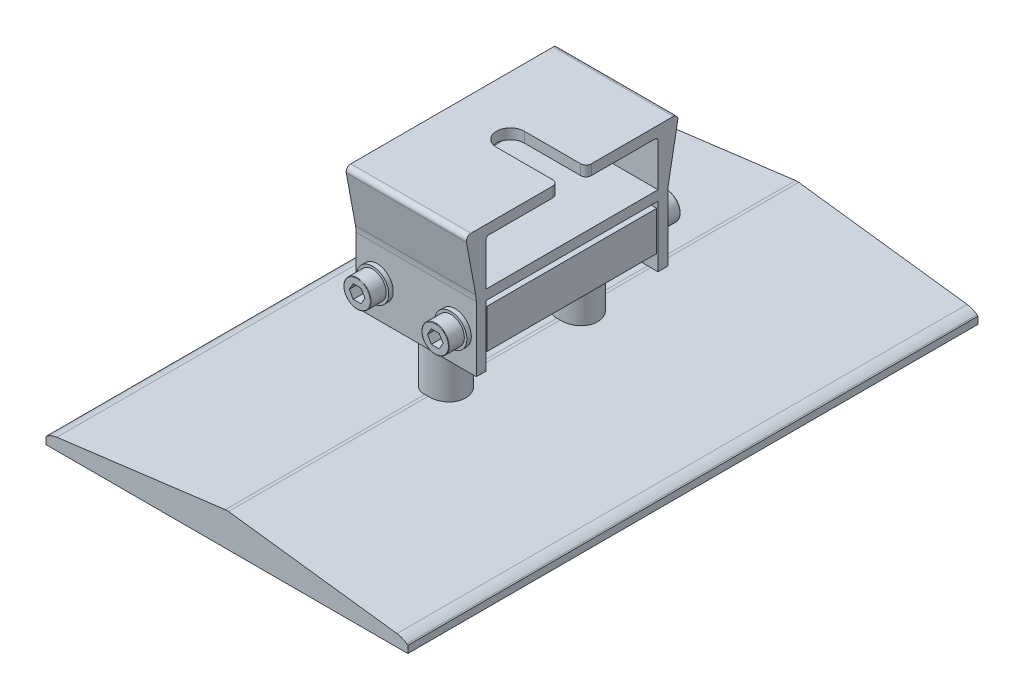
from build123d import *

# Parameters (mm, degrees)
BOSS_EXTRUDE1_DEPTH      = 86.315
FILLET1_R                = 6.35
FILLET2_R                = 3.81
SKETCH2_R                = 5.925
BOSS_EXTRUDE2_DEPTH      = 30.52
SKETCH4_W                = 36.2
SKETCH4_H                = 51.45
BOSS_EXTRUDE3_DEPTH      = 11.87
CUT_EXTRUDE2_DEPTH       = 19.99
CUT_EXTRUDE2_DEPTH_BACK  = 19.99
SKETCH5_W                = 11.85
SKETCH5_H                = 1
BOSS_EXTRUDE4_REACH      = 108.687
BOSS_EXTRUDE5_DEPTH      = 18.2
FILLET3_R                = 1.4
FILLET4_R                = 10.16
FILLET5_R                = 0.762
BOSS_EXTRUDE6_DEPTH      = 18.2
BOSS_EXTRUDE6_DEPTH_BACK = 18.2
SKETCH10_W               = 52.030012
SKETCH10_H               = 3
CUT_EXTRUDE3_DEPTH       = 9.476
FILLET6_R                = 1.65
SKETCH12_R               = 4.875
BOSS_EXTRUDE7_DEPTH      = 1.35
SKETCH13_R               = 4.1
BOSS_EXTRUDE8_DEPTH      = 4.7
CUT_EXTRUDE4_DEPTH       = 3.68
FILLET7_R                = 0.127
FILLET7_OF_MIRROR1_R     = 0.127
MIRROR2_OUTLINE_W        = 4.875
MIRROR2_OUTLINE_H        = 1.35
MIRROR2_START            = -35.065
MIRROR2_2_OUTLINE_R      = 4.1
MIRROR2_2_DEPTH          = 6.05
MIRROR2_START_2          = -31.385
MIRROR2_3_DEPTH          = 2.37
MIRROR2_START_3          = -30.365
MIRROR2_4_OUTLINE_R      = 4.875
MIRROR2_4_OUTLINE_R_2    = 4.1
MIRROR2_4_DEPTH          = 1.35


with BuildPart() as part:
    # Sketch1 → Boss-Extrude1 (new, symmetric)
    with BuildSketch(Plane.XY):
        Polygon((-54.775, 0), (54.775, 0), (54.775, 2.16), (53.145, 3.3779968), (0, 10.16), (-53.145, 3.3779968), (-54.775, 2.16), align=None)
    extrude(amount=BOSS_EXTRUDE1_DEPTH, both=True)

    # Fillet1
    fillet1_edges = [part.edges().sort_by_distance(p)[0] for p in [
        (53.145, 3.3779968, 0),
        (-53.145, 3.3779968, 0),
    ]]
    fillet(fillet1_edges, radius=FILLET1_R)

    # Fillet2
    fillet2_edges = [part.edges().sort_by_distance(p)[0] for p in [
        (0, 10.16, 0),
    ]]
    fillet(fillet2_edges, radius=FILLET2_R)

    # Sketch2 → Boss-Extrude2 (add)
    with BuildSketch(Plane(origin=(0, 0, 0), x_dir=(1, 0, 0), z_dir=(0, 1, 0))):
        with Locations(Location((0, 19.99, 0), (0, 0, 94.669041766))):
            Circle(SKETCH2_R)
        with Locations(Location((0, -19.99, 0), (0, 0, 94.669041766))):
            Circle(SKETCH2_R)
    extrude(amount=BOSS_EXTRUDE2_DEPTH)

    # Sketch4 → Boss-Extrude3 (add)
    with BuildSketch(Plane(origin=(0, 30.52, 0), x_dir=(1, 0, 0), z_dir=(0, 1, 0))):
        Rectangle(SKETCH4_W, SKETCH4_H)
    extrude(amount=BOSS_EXTRUDE3_DEPTH)

    # Sketch5 → Cut-Extrude2 (cut, two sides: drawn at the far end of the back side and taken through both)
    with BuildSketch(Plane.XY.offset(-CUT_EXTRUDE2_DEPTH_BACK)):
        with Locations((0, 31.02)):
            Rectangle(SKETCH5_W, SKETCH5_H)
    extrude(amount=CUT_EXTRUDE2_DEPTH + CUT_EXTRUDE2_DEPTH_BACK, mode=Mode.SUBTRACT)

    # Sketch8 → Boss-Extrude4 (add, up to next)
    with BuildSketch(Plane(origin=(0, 30.52, 0), x_dir=(1, 0, 0), z_dir=(0, 1, 0)), mode=Mode.PRIVATE) as boss_extrude4_sk1:
        with BuildLine():
            Line((5.925, 19.99), (-5.925, 19.99))
            ThreePointArc((-5.925, 19.99), (0, 14.065), (5.925, 19.99))
        make_face()
    boss_extrude4_tool1 = extrude(boss_extrude4_sk1.sketch, amount=BOSS_EXTRUDE4_REACH, mode=Mode.PRIVATE) - part.part
    # Sketch8 → Boss-Extrude4 (add, up to next)
    with BuildSketch(Plane(origin=(0, 30.52, 0), x_dir=(1, 0, 0), z_dir=(0, 1, 0)), mode=Mode.PRIVATE) as boss_extrude4_sk2:
        with BuildLine():
            Line((-5.925, -19.99), (5.925, -19.99))
            ThreePointArc((5.925, -19.99), (0, -14.065), (-5.925, -19.99))
        make_face()
    boss_extrude4_tool2 = extrude(boss_extrude4_sk2.sketch, amount=BOSS_EXTRUDE4_REACH, mode=Mode.PRIVATE) - part.part
    add(boss_extrude4_tool1.solids().sort_by_distance((0, 30.52, -17.475352))[0])
    add(boss_extrude4_tool2.solids().sort_by_distance((0, 30.52, 17.475352))[0])


with BuildPart() as body_2:
    # Sketch9 → Boss-Extrude5 (new, symmetric)
    with BuildSketch(Plane(origin=(0, 0, 0), x_dir=(0, 0, -1), z_dir=(1, 0, 0))):
        Polygon((-26.015006, 25.648452793), (-26.015006, 60.948452793), (26.015006, 60.948452793), (26.015006, 25.648452793), (29.015, 25.648452793), (29.015, 46.248452793), (32.29, 64.068452793), (-32.29, 64.068452793), (-29.015, 46.248452793), (-29.015, 25.648452793), align=None)
    extrude(amount=BOSS_EXTRUDE5_DEPTH, both=True)

    # Fillet3
    fillet3_edges = [body_2.edges().sort_by_distance(p)[0] for p in [
        (0, 64.068452793, 32.29),
        (0, 64.068452793, -32.29),
    ]]
    fillet(fillet3_edges, radius=FILLET3_R)

    # Fillet4
    fillet4_edges = [body_2.edges().sort_by_distance(p)[0] for p in [
        (0, 46.248452793, 29.015),
        (0, 46.248452793, -29.015),
    ]]
    fillet(fillet4_edges, radius=FILLET4_R)

    # Fillet5
    fillet5_edges = [body_2.edges().sort_by_distance(p)[0] for p in [
        (0, 60.948452793, -26.015006),
        (0, 60.948452793, 26.015006),
    ]]
    fillet(fillet5_edges, radius=FILLET5_R)

    # Sketch10 → Boss-Extrude6 (add, two sides: drawn at the far end of the back side and taken through both)
    with BuildSketch(Plane(origin=(0, 0, 0), x_dir=(0, 0, -1), z_dir=(1, 0, 0)).offset(-BOSS_EXTRUDE6_DEPTH_BACK)):
        with Locations((0, 45.656455993)):
            Rectangle(SKETCH10_W, SKETCH10_H)
    extrude(amount=BOSS_EXTRUDE6_DEPTH + BOSS_EXTRUDE6_DEPTH_BACK)

    # Sketch11 → Cut-Extrude3 (cut)
    with BuildSketch(Plane(origin=(0, 64.068452793, 0), x_dir=(1, 0, 0), z_dir=(0, 1, 0))):
        with BuildLine():
            Line((-0.49, 4.21), (24.887668413, 4.21))
            Line((24.887668413, 4.21), (24.887668413, -4.21))
            Line((24.887668413, -4.21), (-0.49, -4.21))
            ThreePointArc((-0.49, -4.21), (-4.7, 0), (-0.49, 4.21))
        make_face()
    extrude(amount=-CUT_EXTRUDE3_DEPTH, mode=Mode.SUBTRACT)

    # Fillet6
    fillet6_edges = [body_2.edges().sort_by_distance(p)[0] for p in [
        (18.2, 62.508452793, 4.21),
        (18.2, 62.508452793, -4.21),
    ]]
    fillet(fillet6_edges, radius=FILLET6_R)

    # Sketch12 → Boss-Extrude7 (add)
    with BuildSketch(Plane.XY.offset(29.015)):
        with Locations(Location((-11.825, 35.413452793, 0), (0, 0, 180))):
            Circle(SKETCH12_R)
    boss_extrude7 = extrude(amount=BOSS_EXTRUDE7_DEPTH)

    # Sketch13 → Boss-Extrude8 (add)
    with BuildSketch(Plane.XY.offset(30.365)):
        with Locations((-11.825, 35.413452793)):
            Circle(SKETCH13_R)
    boss_extrude8 = extrude(amount=BOSS_EXTRUDE8_DEPTH)

    # Sketch14 → Cut-Extrude4 (cut)
    with BuildSketch(Plane.XY.offset(35.065)):
        Polygon((-10.645, 37.457272746), (-13.005, 37.457272746), (-14.185, 35.413452793), (-13.005, 33.36963284), (-10.645, 33.36963284), (-9.465, 35.413452793), align=None)
    cut_extrude4 = extrude(amount=-CUT_EXTRUDE4_DEPTH, mode=Mode.SUBTRACT)

    # Fillet7
    fillet7_edges = [body_2.edges().sort_by_distance(p)[0] for p in [
        (-15.925, 35.413452793, 35.065),
    ]]
    fillet(fillet7_edges, radius=FILLET7_R)

    # Mirror1: Boss-Extrude7, Boss-Extrude8, Cut-Extrude4 across plane
    add(boss_extrude7.mirror(Plane(origin=(0, 0, 0), x_dir=(0, 0, 1), z_dir=(1, 0, 0))))
    add(boss_extrude8.mirror(Plane(origin=(0, 0, 0), x_dir=(0, 0, 1), z_dir=(1, 0, 0))))
    add(cut_extrude4.mirror(Plane(origin=(0, 0, 0), x_dir=(0, 0, 1), z_dir=(1, 0, 0))), mode=Mode.SUBTRACT)

    # Fillet7 of Mirror1
    fillet7_of_mirror1_edges = [body_2.edges().sort_by_distance(p)[0] for p in [
        (15.925, 35.413452793, 35.065),
    ]]
    fillet(fillet7_of_mirror1_edges, radius=FILLET7_OF_MIRROR1_R)

    # Mirror2: read off the stored shape, not the designer's step
    # Mirror2 outline → Mirror2 (revolve)
    with BuildSketch(Plane(origin=(-11.825, 35.413452793, 0), x_dir=(1, 0, 0), z_dir=(0, -1, 0))):
        with Locations((2.4375, -29.69)):
            Rectangle(MIRROR2_OUTLINE_W, MIRROR2_OUTLINE_H)
    revolve(axis=Axis((-11.825, 35.413452793, 0), (0, 0, 1)))

    # Mirror2 2 outline → Mirror2 2 (add)
    # profile 1 of 2: a face of its own
    with BuildSketch(Plane.XY.offset(MIRROR2_START)):
        with Locations((-11.825, 35.413452793)):
            Circle(MIRROR2_2_OUTLINE_R)
        Polygon((-13.005, 37.457272746), (-10.645, 37.457272746), (-9.465, 35.413452793), (-10.645, 33.36963284), (-13.005, 33.36963284), (-14.185, 35.413452793), align=None, mode=Mode.SUBTRACT)
    # profile 2 of 2: a face of its own
    with BuildSketch(Plane.XY.offset(MIRROR2_START)):
        with Locations((11.825, 35.413452793)):
            Circle(MIRROR2_2_OUTLINE_R)
        Polygon((13.005, 33.36963284), (10.645, 33.36963284), (9.465, 35.413452793), (10.645, 37.457272746), (13.005, 37.457272746), (14.185, 35.413452793), align=None, mode=Mode.SUBTRACT)
    extrude(amount=MIRROR2_2_DEPTH)

    # Mirror2 3 outline → Mirror2 3 (add)
    with BuildSketch(Plane.XY.offset(MIRROR2_START_2)):
        Polygon((-9.465, 35.413452793), (-10.645, 37.457272746), (-13.005, 37.457272746), (-14.185, 35.413452793), (-13.005, 33.36963284), (-10.645, 33.36963284), align=None)
        Polygon((9.465, 35.413452793), (10.645, 33.36963284), (13.005, 33.36963284), (14.185, 35.413452793), (13.005, 37.457272746), (10.645, 37.457272746), align=None)
    extrude(amount=MIRROR2_3_DEPTH)

    # Mirror2 4 outline → Mirror2 4 (add)
    with BuildSketch(Plane.XY.offset(MIRROR2_START_3)):
        with Locations((11.825, 35.413452793)):
            Circle(MIRROR2_4_OUTLINE_R)
        with Locations((11.825, 35.413452793)):
            Circle(MIRROR2_4_OUTLINE_R_2, mode=Mode.SUBTRACT)
    extrude(amount=MIRROR2_4_DEPTH)

    # Mirror2 5 outline → Mirror2 5 (revolve, cut)
    with BuildSketch(Plane(origin=(11.825, 35.413452793, 0), x_dir=(1, 0, 0), z_dir=(0, -1, 0))):
        with BuildLine():
            Line((4.1, -35.065), (4.1, -34.938))
            ThreePointArc((4.1, -34.938), (4.062802561, -35.027802561), (3.973, -35.065))
            Line((3.973, -35.065), (4.1, -35.065))
        make_face()
    revolve(axis=Axis((11.825, 35.413452793, 0), (0, 0, 1)), mode=Mode.SUBTRACT)

    # Mirror2 6 outline → Mirror2 6 (revolve, cut)
    with BuildSketch(Plane(origin=(-11.825, 35.413452793, 0), x_dir=(1, 0, 0), z_dir=(0, -1, 0))):
        with BuildLine():
            Line((4.1, -35.065), (4.1, -34.938))
            ThreePointArc((4.1, -34.938), (4.062802561, -35.027802561), (3.973, -35.065))
            Line((3.973, -35.065), (4.1, -35.065))
        make_face()
    revolve(axis=Axis((-11.825, 35.413452793, 0), (0, 0, 1)), mode=Mode.SUBTRACT)


solid = Compound([part.part, body_2.part])
